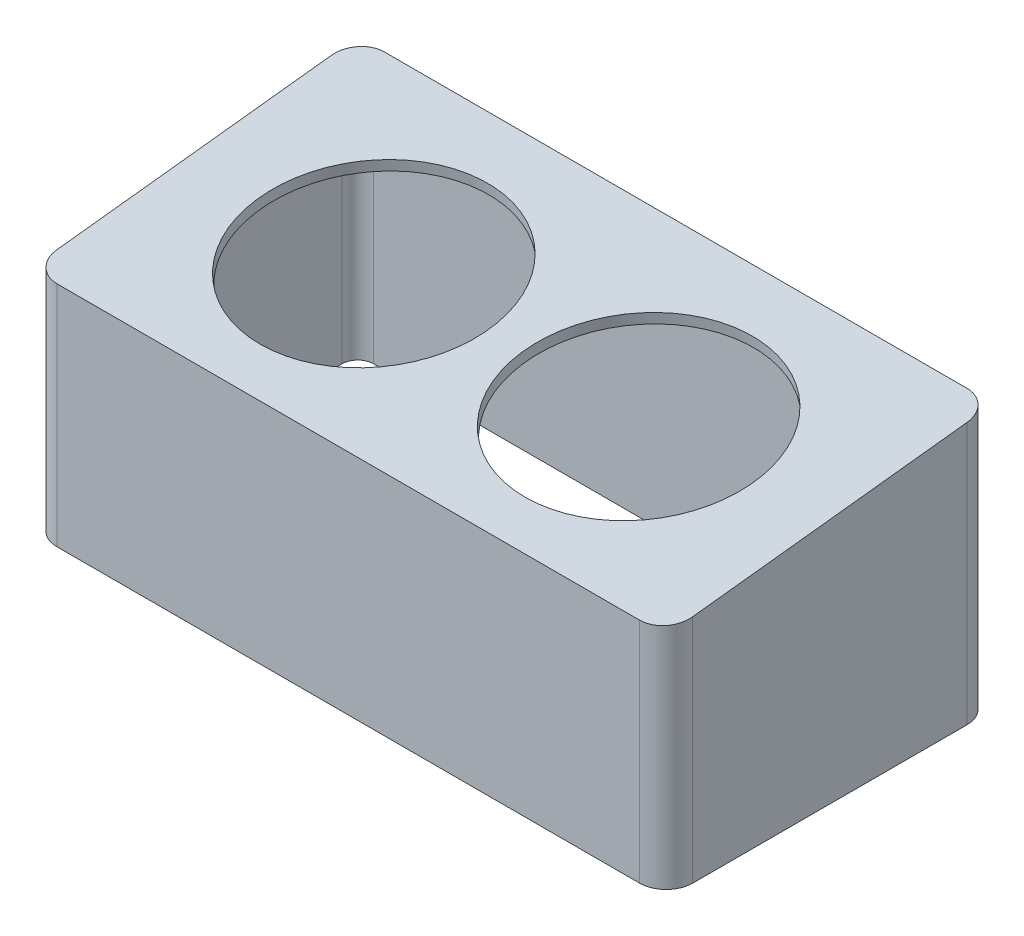
from build123d import *

# Parameters (mm, degrees)
EXTRUDE_6_DEPTH          = 50
CUT_EXTRUDE_1_DEPTH      = 134.718463472
CUT_EXTRUDE_1_DEPTH_BACK = 134.718463472
SKETCH_5_R               = 21.601831088
CUT_EXTRUDE_2_DEPTH      = 99.714931123
SHELL_3_T                = -2


with BuildPart() as part:
    # 草图3 → 凸台-拉伸6 (new body)
    with BuildSketch(Plane(origin=(0, 0, 0), x_dir=(1, 0, 0), z_dir=(0, 1, 0))):
        with BuildLine():
            Line((-35.258285714, 30.485027968), (74.741714286, 30.485027968))
            ThreePointArc((74.741714286, 30.485027968), (78.277248192, 29.020561874), (79.741714286, 25.485027968))
            Line((79.741714286, 25.485027968), (79.741714286, -26.314972032))
            ThreePointArc((79.741714286, -26.314972032), (78.277248192, -29.850505938), (74.741714286, -31.314972032))
            Line((74.741714286, -31.314972032), (-35.258285714, -31.314972032))
            ThreePointArc((-35.258285714, -31.314972032), (-38.79381962, -29.850505938), (-40.258285714, -26.314972032))
            Line((-40.258285714, -26.314972032), (-40.258285714, 25.485027968))
            ThreePointArc((-40.258285714, 25.485027968), (-38.79381962, 29.020561874), (-35.258285714, 30.485027968))
        make_face()
    extrude(amount=EXTRUDE_6_DEPTH)

    # 草图4 → 切除-拉伸1 (cut, two sides: drawn at the far end of the back side and taken through both)
    with BuildSketch(Plane(origin=(79.741714286, 0, 0), x_dir=(0, 0, -1), z_dir=(1, 0, 0)).offset(-CUT_EXTRUDE_1_DEPTH_BACK)):
        Polygon((30.485027968, 50), (-31.314972032, 43), (-31.314972032, 50), align=None)
    extrude(amount=CUT_EXTRUDE_1_DEPTH + CUT_EXTRUDE_1_DEPTH_BACK, mode=Mode.SUBTRACT)

    # 草图5 → 切除-拉伸2 (cut, through all)
    with BuildSketch(Plane(origin=(0, 45.957380333, 5.205528517), x_dir=(1, 0, 0), z_dir=(0, 0.9936461847514532, 0.11254892060291542))):
        with Locations((44.741714286, 3.723601101)):
            Circle(SKETCH_5_R)
        with Locations((-5.258285714, 3.723601101)):
            Circle(SKETCH_5_R)
    extrude(amount=-CUT_EXTRUDE_2_DEPTH, mode=Mode.SUBTRACT)

    # 抽壳3
    shell_3_openings = [part.faces().sort_by_distance(p)[0] for p in [
        (-26.860116802, 21.94357386, -1.261893386),
        (23.139883198, 21.94357386, -1.261893386),
        (19.741714286, 0, 3.178829845),
    ]]
    offset(amount=SHELL_3_T, openings=shell_3_openings, kind=Kind.INTERSECTION)


solid = part.part
